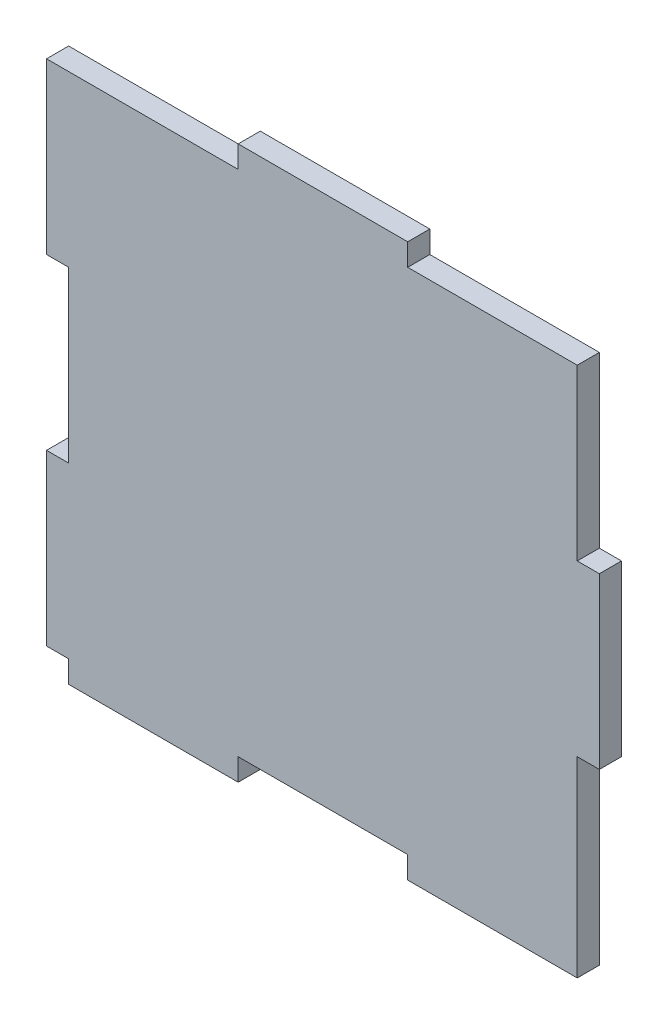
from build123d import *

# Parameters (mm, degrees)
BOSS_EXTRUDE1_DEPTH = 6


with BuildPart() as part:
    # Sketch1 → Boss-Extrude1 (new body)
    with BuildSketch(Plane.XY):
        Polygon((-69, 69), (-23, 69), (-23, 75), (23, 75), (23, 69), (69, 69), (69, 23), (75, 23), (75, -23), (69, -23), (69, -69), (69, -75), (23, -75), (23, -69), (-23, -69), (-23, -75), (-69, -75), (-69, -69), (-75, -69), (-75, -23), (-69, -23), (-69, 23), (-75, 23), (-75, 69), align=None)
    extrude(amount=BOSS_EXTRUDE1_DEPTH)


solid = part.part
